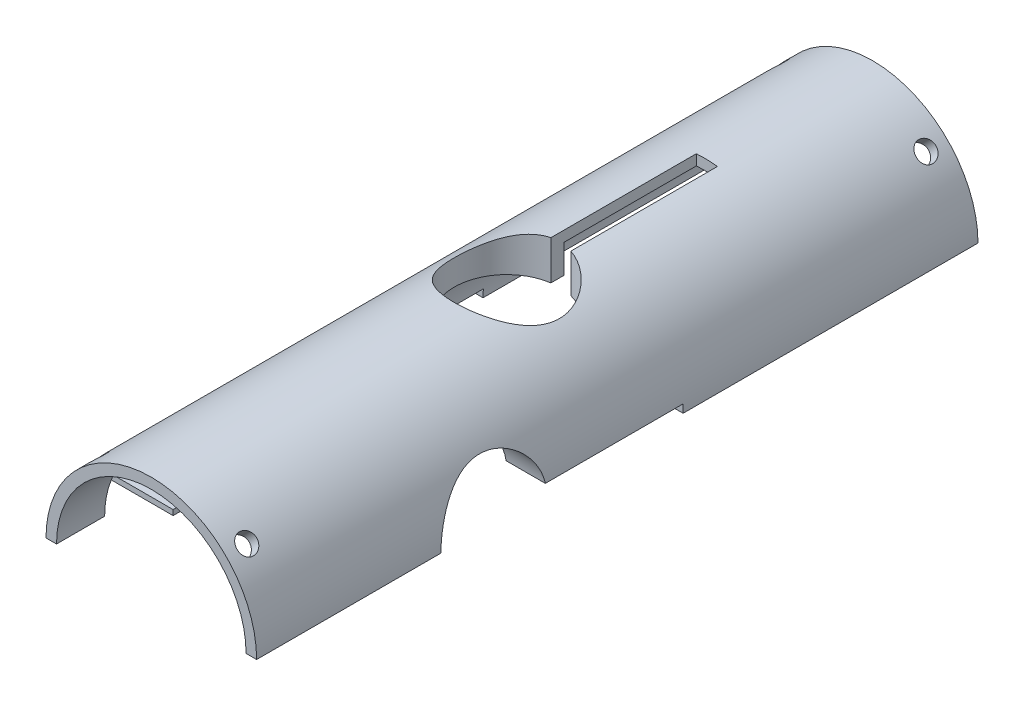
from build123d import *
from build123d.topology import SkipClean

# Parameters (mm, degrees)
SKETCH1_R                 = 20.000000000000004
SKETCH1_R_2               = 18.000000000000004
BOSS_EXTRUDE1_DEPTH       = 30
SKETCH2_R                 = 10.000000000000005
CUT_EXTRUDE1_DEPTH        = 20
SKETCH3_W                 = 3
SKETCH3_H                 = 14.18919425162652
CUT_EXTRUDE2_DEPTH        = 25
BOSS_EXTRUDE2_START       = 22.5
BOSS_EXTRUDE2_DEPTH       = 22.5
BOSS_EXTRUDE3_START       = 32
SKETCH5_R                 = 20
SKETCH5_R_2               = 18.000000000000004
BOSS_EXTRUDE3_DEPTH       = 32
SKETCH7_R                 = 20
SKETCH7_R_2               = 18.000000000000004
BOSS_EXTRUDE5_DEPTH       = 52.5
SKETCH8_R                 = 10.000000000000002
CUT_EXTRUDE3_DEPTH        = 22.500000000000004
CUT_EXTRUDE7_DEPTH        = 94.84162204766672
BOSS_EXTRUDE6_REACH       = 92.898
SKETCH17_R                = 12.500000000000002
SKETCH17_R_2              = 9.999999999999961
BOSS_EXTRUDE7_REACH       = 89.214
BOSS_EXTRUDE7_END_RADIUS  = 18.000000000000004
CUT_EXTRUDE9_DEPTH        = 5
BOSS_EXTRUDE8_REACH       = 141.889
CUT_EXTRUDE10_START       = -9.140015981
CUT_EXTRUDE10_DEPTH       = 9.140015981
BOSS_EXTRUDE9_START       = -18
BOSS_EXTRUDE9_DEPTH       = 18
CUT_EXTRUDE12_START       = -5
CUT_EXTRUDE12_DEPTH       = 5
CUT_EXTRUDE13_DEPTH       = 93.50158778794676
CUT_EXTRUDE14_START       = -20.999999999999996
CUT_EXTRUDE14_DEPTH       = 20.999999999999996
BOSS_EXTRUDE10_REACH      = 92.898
BOSS_EXTRUDE10_END_RADIUS = 18.000000000000004
SKETCH29_R                = 12.500000000000004
SKETCH29_R_2              = 10.000000000000005
SKETCH30_W                = 4.0000000000000036
SKETCH30_H                = 3.5793485997430934
CUT_EXTRUDE15_DEPTH       = 35.50000000000001
SKETCH32_W                = 28.000000000000007
SKETCH32_H                = 3
CUT_EXTRUDE17_DEPTH       = 86
CUT_EXTRUDE18_REACH       = 97.591
CUT_EXTRUDE18_END_RADIUS  = 18.000000000000004
SKETCH33_R                = 1.875000000000003
CIRPATTERN3_COUNT         = 4
MIRROR3_COPY_1_REACH      = 97.591
MIRROR3_COPY_1_END_RADIUS = 18.000000000000004
MIRROR3_COPY_1_SKETCH_R   = 1.875000000000003
MIRROR3_COPY_2_REACH      = 97.591
MIRROR3_COPY_2_END_RADIUS = 18.000000000000004
MIRROR3_COPY_2_SKETCH_R   = 1.875000000000003
MIRROR3_COPY_3_REACH      = 97.591
MIRROR3_COPY_3_END_RADIUS = 18.000000000000004
MIRROR3_COPY_3_SKETCH_R   = 1.875000000000003
CUT_EXTRUDE20_DEPTH       = 140


# Read off the part's stored shape, not the designer's step: Boss-Extrude9
with BuildPart() as part:
    # Sketch1 → Boss-Extrude1 (new body)
    with BuildSketch(Plane.XY):
        Circle(SKETCH1_R)
        Circle(SKETCH1_R_2, mode=Mode.SUBTRACT)
    extrude(amount=BOSS_EXTRUDE1_DEPTH)

    # Sketch2 → Cut-Extrude1 (cut, symmetric)
    with BuildSketch(Plane(origin=(0, 0, 0), x_dir=(1, 0, 0), z_dir=(0, 1, 0))):
        with Locations(Location((0, -15, 0), (0, 0, 270))):
            Circle(SKETCH2_R)
    extrude(amount=CUT_EXTRUDE1_DEPTH, both=True, mode=Mode.SUBTRACT)

    # Sketch3 → Cut-Extrude2 (cut, symmetric)
    with BuildSketch(Plane(origin=(0, 0, 0), x_dir=(1, 0, 0), z_dir=(0, 1, 0))):
        with Locations((0, -0.9987420960771436)):
            Rectangle(SKETCH3_W, SKETCH3_H)
    extrude(amount=CUT_EXTRUDE2_DEPTH, both=True, mode=Mode.SUBTRACT)

    # Sketch4 → Boss-Extrude2 (add)
    with SkipClean():  # the faces are left unmerged after this step: merging them gives an invalid solid
        with BuildSketch(Plane(origin=(0, 0, 0), x_dir=(-1, 0, 0), z_dir=(0, 0, -1)).offset(BOSS_EXTRUDE2_START)):
            with BuildLine():
                ThreePointArc((1.5, -19.94367067517913), (20, -2e-15), (1.5000000000000044, 19.94367067517913))
                Line((1.5, 19.94367067517913), (1.5, 17.937391114652137))
                ThreePointArc((1.4999999999997762, 17.93739111465212), (18.000000000000004, 2.44e-15), (1.4999999999997808, -17.93739111465212))
                Line((1.5, -17.937391114652133), (1.5, -19.94367067517913))
            make_face()
            with BuildLine():
                Line((-1.5, 17.937391114652154), (-1.5, 19.94367067517913))
                ThreePointArc((-1.5, 19.94367067517913), (-20, 2.45e-15), (-1.5000000000000002, -19.94367067517913))
                Line((-1.5, -19.94367067517913), (-1.5, -17.937391114652154))
                ThreePointArc((-1.4999999999996771, -17.937391114652126), (-18.000000000000004, 2.2e-15), (-1.499999999999665, 17.937391114652126))
            make_face()
        extrude(amount=-BOSS_EXTRUDE2_DEPTH)

    # Sketch5 → Boss-Extrude3 (add)
    with SkipClean():  # the faces are left unmerged after this step: merging them gives an invalid solid
        with BuildSketch(Plane(origin=(0, 0, -22.5), x_dir=(-1, 0, 0), z_dir=(0, 0, -1)).offset(BOSS_EXTRUDE3_START)):
            Circle(SKETCH5_R)
            Circle(SKETCH5_R_2, mode=Mode.SUBTRACT)
        extrude(amount=-BOSS_EXTRUDE3_DEPTH)

    # Sketch7 → Boss-Extrude5 (add)
    with SkipClean():  # the faces are left unmerged after this step: merging them gives an invalid solid
        with BuildSketch(Plane.XY.offset(30)):
            with Locations(Location((0, 0, 0), (0, 0, 180))):
                Circle(SKETCH7_R)
            with Locations(Location((0, 0, 0), (0, 0, 180))):
                Circle(SKETCH7_R_2, mode=Mode.SUBTRACT)
        extrude(amount=BOSS_EXTRUDE5_DEPTH)

    # Sketch8 → Cut-Extrude3 (cut, symmetric)
    with SkipClean():  # the faces are left unmerged after this step: merging them gives an invalid solid
        with BuildSketch(Plane(origin=(0, 0, 0), x_dir=(0, 0, -1), z_dir=(1, 0, 0))):
            with Locations((-37.5, 0)):
                Circle(SKETCH8_R)
        extrude(amount=CUT_EXTRUDE3_DEPTH, both=True, mode=Mode.SUBTRACT)

    # Sketch14 → Cut-Extrude7 (cut, through all)
    with SkipClean():  # the faces are left unmerged after this step: merging them gives an invalid solid
        with BuildSketch(Plane(origin=(0, 20, 0), x_dir=(1, 0, 0), z_dir=(0, 1, 0))):
            Polygon((1.5, 22.5), (2.5, 22.5), (2.500000000000004, -5.317541634481452), (1.5000000000000036, -5.317541634481452), align=None)
        extrude(amount=-CUT_EXTRUDE7_DEPTH, mode=Mode.SUBTRACT)

    # Sketch17 → Boss-Extrude6 (add, up to next)
    with BuildSketch(Plane(origin=(12.5, 0, 0), x_dir=(0, 0, -1), z_dir=(1, 0, 0)), mode=Mode.PRIVATE) as boss_extrude6_sk1:
        with Locations(Location((-37.49999999999996, 3.469e-14, 0), (0, 0, 180))):
            Circle(SKETCH17_R)
        with Locations((-37.49999999999996, 3.469e-14)):
            Circle(SKETCH17_R_2, mode=Mode.SUBTRACT)
    boss_extrude6_tool1 = extrude(boss_extrude6_sk1.sketch, amount=BOSS_EXTRUDE6_REACH, mode=Mode.PRIVATE) - part.part
    boss_extrude6 = boss_extrude6_tool1.solids().sort_by_distance((12.5, 0, 25.353553))[0]
    add(boss_extrude6)

    # Boss-Extrude7: up to this cylinder (the profile starts inside it)
    with SkipClean():  # the faces are left unmerged after this step: merging them gives an invalid solid
        boss_extrude7_end = Plane(origin=(0, 0, 62.959984), z_dir=(0, 0, -1)) * Cylinder(BOSS_EXTRUDE7_END_RADIUS, 215.428, mode=Mode.PRIVATE)
        # Sketch18 → Boss-Extrude7 (add, up to the surface)
        with BuildSketch(Plane(origin=(0, 0, 0), x_dir=(0, 0, -1), z_dir=(1, 0, 0)), mode=Mode.PRIVATE) as boss_extrude7_sk1:
            with BuildLine():
                Line((-73.35998401853058, 6.599999999999998), (-52.55998401853059, 6.599999999999998))
                ThreePointArc((-52.55998401853059, 6.599999999999997), (-51.60538986392875, 6.204594154601842), (-51.20998401853059, 5.250000000000001))
                Line((-51.20998401853059, 5.250000000000001), (-51.20998401853059, -5.250000000000001))
                ThreePointArc((-51.20998401853059, -5.250000000000001), (-51.60538986392876, -6.204594154601836), (-52.55998401853059, -6.599999999999998))
                Line((-52.55998401853059, -6.599999999999998), (-73.35998401853058, -6.600000000000001))
                Line((-73.35998401853057, -6.6), (-73.35998401853058, -7.600000000000001))
                Line((-73.35998401853058, -7.600000000000001), (-52.55998401853059, -7.599999999999997))
                ThreePointArc((-52.55998401853059, -7.6), (-50.89828308274221, -6.911700935788383), (-50.20998401853059, -5.250000000000001))
                Line((-50.20998401853059, -5.250000000000001), (-50.20998401853059, 5.250000000000001))
                ThreePointArc((-50.20998401853059, 5.250000000000001), (-50.8982830827422, 6.911700935788389), (-52.55998401853059, 7.600000000000003))
                Line((-52.55998401853059, 7.600000000000001), (-73.35998401853058, 7.599999999999998))
                Line((-73.35998401853058, 7.599999999999998), (-73.35998401853057, 6.6))
            make_face()
        boss_extrude7_tool1 = extrude(boss_extrude7_sk1.sketch, amount=-BOSS_EXTRUDE7_REACH, mode=Mode.PRIVATE) & boss_extrude7_end
        add(boss_extrude7_tool1.solids().sort_by_distance((0, 6.876941, 62.959984))[0])

    # Sketch19 → Cut-Extrude9 (cut)
    with SkipClean():  # the faces are left unmerged after this step: merging them gives an invalid solid
        with BuildSketch(Plane(origin=(0, 0, 0), x_dir=(0, 0, -1), z_dir=(1, 0, 0))):
            with BuildLine():
                Line((-50.20998401853059, -5.250000000000001), (-50.20998401853059, 5.250000000000001))
                ThreePointArc((-50.20998401853059, 5.250000000000001), (-50.8982830827422, 6.911700935788389), (-52.55998401853059, 7.6000000000000005))
                Line((-52.55998401853059, 7.6000000000000005), (-73.35998401853058, 7.599999999999998))
                Line((-73.35998401853058, 7.599999999999998), (-73.35998401853058, 6.599999999999998))
                Line((-73.35998401853058, 6.599999999999998), (-52.55998401853059, 6.599999999999998))
                ThreePointArc((-52.55998401853059, 6.599999999999998), (-51.60538986392875, 6.204594154601841), (-51.20998401853059, 5.250000000000001))
                Line((-51.20998401853059, 5.250000000000001), (-51.20998401853059, -5.250000000000001))
                ThreePointArc((-51.20998401853059, -5.250000000000001), (-51.60538986392876, -6.204594154601838), (-52.55998401853059, -6.599999999999998))
                Line((-52.55998401853059, -6.599999999999998), (-73.35998401853058, -6.600000000000001))
                Line((-73.35998401853058, -6.600000000000001), (-73.35998401853058, -7.600000000000001))
                Line((-73.35998401853058, -7.600000000000001), (-52.55998401853059, -7.599999999999997))
                ThreePointArc((-52.55998401853059, -7.599999999999997), (-50.89828308274221, -6.911700935788385), (-50.20998401853059, -5.250000000000001))
            make_face()
        extrude(amount=-CUT_EXTRUDE9_DEPTH, mode=Mode.SUBTRACT)

    # Sketch20 → Boss-Extrude8 (add, up to next)
    with BuildSketch(Plane.XY.offset(82.49999999999999), mode=Mode.PRIVATE) as boss_extrude8_sk1:
        with BuildLine():
            Line((-16.746342884343438, -6.600000000000001), (-16.746342884343438, 6.599999999999998))
            ThreePointArc((-16.746342884343434, 6.600000000000001), (-18, 2.2e-15), (-16.746342884343438, -6.599999999999998))
        make_face()
    boss_extrude8_tool1 = extrude(boss_extrude8_sk1.sketch, amount=-BOSS_EXTRUDE8_REACH, mode=Mode.PRIVATE) - part.part
    add(boss_extrude8_tool1.solids().sort_by_distance((-17.249333, 0, 82.5))[0])

    # Sketch21 → Cut-Extrude10 (cut)
    with SkipClean():  # the faces are left unmerged after this step: merging them gives an invalid solid
        with BuildSketch(Plane.XY.offset(82.49999999999999).offset(CUT_EXTRUDE10_START)):
            with BuildLine():
                ThreePointArc((-16.746342884343434, 6.600000000000001), (-18, 2.2e-15), (-16.746342884343438, -6.599999999999998))
                Line((-16.746342884343438, -6.600000000000003), (-16.746342884343438, 6.600000000000003))
            make_face()
            with BuildLine():
                Line((-16.746342884343438, 6.600000000000003), (-16.746342884343438, -6.600000000000003))
                ThreePointArc((-16.746342884343438, -6.599999999999998), (3.3590049182621122, -17.683808581838104), (18, -4.41e-15))
                ThreePointArc((18, 0), (3.3590049182621167, 17.683808581838104), (-16.746342884343434, 6.600000000000001))
            make_face()
        extrude(amount=CUT_EXTRUDE10_DEPTH, mode=Mode.SUBTRACT)

    # Boss-Extrude9 outline → Boss-Extrude9 (add)
    with SkipClean():  # the faces are left unmerged after this step: merging them gives an invalid solid
        with BuildSketch(Plane(origin=(50.804275903139434, 0, -12.243053878130752), x_dir=(0, 0, -1), z_dir=(0, 1, 0)).offset(BOSS_EXTRUDE9_START)):
            with BuildLine():
                ThreePointArc((12.856946122, 57.908219312), (11.195245186, 57.219920248), (10.506946122, 55.558219312))
                Line((10.506946122, 55.558219312), (10.506946122, 45.045105532))
                ThreePointArc((10.506946122, 45.045105532), (11.199853903, 43.391882613), (12.856917722, 42.708211121))
                Line((12.856917722, 42.708211121), (33.656945683, 42.708219312))
                Line((33.656945683, 42.708219312), (33.656945733, 43.708219312))
                Line((33.656945733, 43.708219312), (12.856917722, 43.708211121))
                ThreePointArc((12.856917722, 43.708211121), (11.905838377, 44.100111702), (11.506946122, 45.048279912))
                Line((11.506946122, 45.048279912), (11.506946122, 55.558219312))
                ThreePointArc((11.506946122, 55.558219312), (11.902351968, 56.512813466), (12.856946122, 56.908219312))
                Line((12.856946122, 56.908219312), (33.656946122, 56.908219312))
                Line((33.656946122, 56.908219312), (33.656946447, 57.908219312))
                Line((33.656946447, 57.908219312), (12.856946122, 57.908219312))
            make_face()
        extrude(amount=BOSS_EXTRUDE9_DEPTH)

    # Sketch26 → Cut-Extrude12 (cut)
    with SkipClean():  # the faces are left unmerged after this step: merging them gives an invalid solid
        with BuildSketch(Plane(origin=(0, 0, 0), x_dir=(-1, 0, 0), z_dir=(0, 1, 0)).offset(CUT_EXTRUDE12_START)):
            with BuildLine():
                Line((-8.096064781732366, -25.099971600575135), (-8.096056591348372, -45.89999956080974))
                Line((-8.096056591348372, -45.89999956080974), (-7.096056591348369, -45.89999956080974))
                Line((-7.096056591348369, -45.89999956080974), (-7.096064781732365, -25.099971600575135))
                ThreePointArc((-7.096064781732365, -25.099971600575135), (-6.704164201464376, -24.148892255031903), (-5.755995991066618, -23.75))
                Line((-5.755995991066618, -23.75), (4.753943408626532, -23.74999999996665))
                ThreePointArc((4.753943408626532, -23.74999999996665), (5.708537563243819, -24.145405845382772), (6.103943408648366, -25.100000000000065))
                Line((6.103943408648366, -25.100000000000065), (6.1039434086368125, -45.900000000000055))
                Line((6.1039434086368125, -45.900000000000055), (7.103943408636799, -45.90000032526164))
                Line((7.103943408636799, -45.90000032526164), (7.103943408636813, -25.100000000000065))
                ThreePointArc((7.103943408636813, -25.100000000000065), (6.415644344422198, -23.438299064204394), (4.753943408626532, -22.74999999996665))
                Line((4.753943408626532, -22.74999999996665), (-5.759170371377929, -22.75))
                ThreePointArc((-5.759170371377929, -22.75), (-7.412393289818503, -23.442907780994286), (-8.096064781732366, -25.099971600575135))
            make_face()
        extrude(amount=CUT_EXTRUDE12_DEPTH, mode=Mode.SUBTRACT)

    # Sketch27 → Cut-Extrude13 (cut, through all)
    with SkipClean():  # the faces are left unmerged after this step: merging them gives an invalid solid
        with BuildSketch(Plane(origin=(-16.746342884343438, 0, 0), x_dir=(0, 0, -1), z_dir=(1, 0, 0))):
            with BuildLine():
                Line((-52.55998401853059, 6.599999999999998), (-73.35998401853058, 6.599999999999998))
                Line((-73.35998401853058, 6.599999999999998), (-73.35998401853011, -6.600000000000003))
                Line((-73.35998401853011, -6.600000000000003), (-52.55998401853059, -6.599999999999994))
                ThreePointArc((-52.55998401853059, -6.599999999999994), (-51.60538986392876, -6.2045941546018355), (-51.20998401853059, -5.250000000000001))
                Line((-51.20998401853059, -5.250000000000001), (-51.20998401853059, 5.250000000000001))
                ThreePointArc((-51.20998401853059, 5.250000000000001), (-51.60538986392875, 6.204594154601841), (-52.55998401853059, 6.599999999999998))
            make_face()
        extrude(amount=-CUT_EXTRUDE13_DEPTH, mode=Mode.SUBTRACT)

    # Sketch28 → Cut-Extrude14 (cut)
    with SkipClean():  # the faces are left unmerged after this step: merging them gives an invalid solid
        with BuildSketch(Plane(origin=(0, -5, 0), x_dir=(1, 0, 0), z_dir=(0, 1, 0)).offset(CUT_EXTRUDE14_START)):
            with BuildLine():
                Line((-6.1039434086368125, 45.900000000000055), (7.096056591348369, 45.89999956080974))
                Line((7.096056591348369, 45.89999956080974), (7.096064781732365, 25.099971600575135))
                ThreePointArc((7.096064781732365, 25.099971600575135), (6.704164201464375, 24.148892255031907), (5.755995991066618, 23.75))
                Line((5.755995991066618, 23.75), (-4.753943408626532, 23.749999999972427))
                ThreePointArc((-4.753943408626532, 23.749999999972427), (-5.708537563247905, 24.145405845378683), (-6.103943408648366, 25.100000000000065))
                Line((-6.103943408648366, 25.100000000000065), (-6.1039434086368125, 45.900000000000055))
            make_face()
        extrude(amount=CUT_EXTRUDE14_DEPTH, mode=Mode.SUBTRACT)

    # Mirror1: Boss-Extrude6 across plane
    with SkipClean():  # the faces are left unmerged after this step: merging them gives an invalid solid
        add(boss_extrude6.mirror(Plane(origin=(0, 0, 0), x_dir=(0, 0, 1), z_dir=(1, 0, 0))))

    # Boss-Extrude10: up to this cylinder (the profile starts inside it)
    with SkipClean():  # the faces are left unmerged after this step: merging them gives an invalid solid
        boss_extrude10_end = Plane(origin=(0, 0, 27.058675), z_dir=(0, 0, -1)) * Cylinder(BOSS_EXTRUDE10_END_RADIUS, 222.796, mode=Mode.PRIVATE)
        # Sketch29 → Boss-Extrude10 (add, up to the surface)
        with BuildSketch(Plane(origin=(0, 12.5, 0), x_dir=(1, 0, 0), z_dir=(0, 1, 0)), mode=Mode.PRIVATE) as boss_extrude10_sk1:
            with Locations(Location((-2.27075e-12, -14.999999999999979, 0), (0, 0, 96.892101339))):
                Circle(SKETCH29_R)
            with Locations(Location((-2.27075e-12, -14.999999999999979, 0), (0, 0, 270))):
                Circle(SKETCH29_R_2, mode=Mode.SUBTRACT)
        boss_extrude10_tool1 = extrude(boss_extrude10_sk1.sketch, amount=BOSS_EXTRUDE10_REACH, mode=Mode.PRIVATE) & boss_extrude10_end
        boss_extrude10 = boss_extrude10_tool1.solids().sort_by_distance((1.457573, 12.5, 27.058675))[0]
        add(boss_extrude10)

    # Mirror2: Boss-Extrude10 across plane
    with SkipClean():  # the faces are left unmerged after this step: merging them gives an invalid solid
        add(boss_extrude10.mirror(Plane.ZX))

    # Sketch30 → Cut-Extrude15 (cut, symmetric)
    with SkipClean():  # the faces are left unmerged after this step: merging them gives an invalid solid
        with BuildSketch(Plane(origin=(0, -12.5, 0), x_dir=(1, 0, 0), z_dir=(0, 1, 0))):
            with Locations((0.5000000000000021, -3.5278673346099048)):
                Rectangle(SKETCH30_W, SKETCH30_H)
        extrude(amount=CUT_EXTRUDE15_DEPTH, both=True, mode=Mode.SUBTRACT)

    # Sketch32 → Cut-Extrude17 (cut)
    with SkipClean():  # the faces are left unmerged after this step: merging them gives an invalid solid
        with BuildSketch(Plane(origin=(20, 0, 0), x_dir=(0, 0, -1), z_dir=(1, 0, 0))):
            with Locations((-15.5, 0)):
                Rectangle(SKETCH32_W, SKETCH32_H)
        extrude(amount=-CUT_EXTRUDE17_DEPTH, mode=Mode.SUBTRACT)

    # Cut-Extrude18: up to this cylinder (the profile starts outside it)
    with SkipClean():  # the faces are left unmerged after this step: merging them gives an invalid solid
        cut_extrude18_end = Plane(origin=(0, 0, -50.5), z_dir=(0, 0, -1)) * Cylinder(CUT_EXTRUDE18_END_RADIUS, 232.182, mode=Mode.PRIVATE)
        # Sketch33 → Cut-Extrude18 (cut, up to the surface)
        with BuildSketch(Plane(origin=(-14.142135623730981, -14.142135623730931, 0), x_dir=(0, 0, -1), z_dir=(-0.7071067811865488, -0.7071067811865464, 0)), mode=Mode.PRIVATE) as cut_extrude18_sk1:
            with Locations(Location((50.5, 0, 0), (0, 0, 90))):
                Circle(SKETCH33_R)
        cut_extrude18_tool1 = extrude(cut_extrude18_sk1.sketch, amount=-CUT_EXTRUDE18_REACH, mode=Mode.PRIVATE) - cut_extrude18_end
        cut_extrude18 = cut_extrude18_tool1.solids().sort_by_distance((-14.142136, -14.142136, -50.5))[0]
        add(cut_extrude18, mode=Mode.SUBTRACT)

    # CirPattern3: Cut-Extrude18 ×4 about axis
    with SkipClean():  # the faces are left unmerged after this step: merging them gives an invalid solid
        cirpattern3_axis = Axis((0, 0, 30), (0, 0, -1))
        for i in range(1, CIRPATTERN3_COUNT):
            add(cut_extrude18.rotate(cirpattern3_axis, i * 360 / CIRPATTERN3_COUNT), mode=Mode.SUBTRACT)

    # Mirror3: Cut-Extrude18 across plane
    with SkipClean():  # the faces are left unmerged after this step: merging them gives an invalid solid
        add(cut_extrude18.mirror(Plane.XY.offset(13.999999999999995)), mode=Mode.SUBTRACT)

    # Mirror3 copy 1: up to this cylinder (the profile starts outside it)
    with SkipClean():  # the faces are left unmerged after this step: merging them gives an invalid solid
        mirror3_copy_1_end = Plane(origin=(0, 0, -50.5), z_dir=(0, 0, -1)) * Cylinder(MIRROR3_COPY_1_END_RADIUS, 232.182, mode=Mode.PRIVATE)
        # Mirror3 copy 1 sketch → Mirror3 copy 1 (cut, up to the surface)
        with BuildSketch(Plane(origin=(-14.142135623730931, 14.142135623730981, 27.99999999999999), x_dir=(0, 0, 1), z_dir=(-0.7071067811865464, 0.7071067811865488, 0)), mode=Mode.PRIVATE) as mirror3_copy_1_sk1:
            with Locations((50.5, 0)):
                Circle(MIRROR3_COPY_1_SKETCH_R)
        mirror3_copy_1_tool1 = extrude(mirror3_copy_1_sk1.sketch, amount=-MIRROR3_COPY_1_REACH, mode=Mode.PRIVATE) - mirror3_copy_1_end
        add(mirror3_copy_1_tool1.solids().sort_by_distance((-14.142136, -14.142136, -50.5))[0], mode=Mode.SUBTRACT)

    # Mirror3 copy 2: up to this cylinder (the profile starts outside it)
    with SkipClean():  # the faces are left unmerged after this step: merging them gives an invalid solid
        mirror3_copy_2_end = Plane(origin=(0, 0, -50.5), z_dir=(0, 0, -1)) * Cylinder(MIRROR3_COPY_2_END_RADIUS, 232.182, mode=Mode.PRIVATE)
        # Mirror3 copy 2 sketch → Mirror3 copy 2 (cut, up to the surface)
        with BuildSketch(Plane(origin=(14.14213562373098, 14.142135623730933, 27.99999999999999), x_dir=(0, 0, 1), z_dir=(0.7071067811865487, 0.7071067811865465, 0)), mode=Mode.PRIVATE) as mirror3_copy_2_sk1:
            with Locations((50.5, 0)):
                Circle(MIRROR3_COPY_2_SKETCH_R)
        mirror3_copy_2_tool1 = extrude(mirror3_copy_2_sk1.sketch, amount=-MIRROR3_COPY_2_REACH, mode=Mode.PRIVATE) - mirror3_copy_2_end
        add(mirror3_copy_2_tool1.solids().sort_by_distance((-14.142136, -14.142136, -50.5))[0], mode=Mode.SUBTRACT)

    # Mirror3 copy 3: up to this cylinder (the profile starts outside it)
    with SkipClean():  # the faces are left unmerged after this step: merging them gives an invalid solid
        mirror3_copy_3_end = Plane(origin=(0, 0, -50.5), z_dir=(0, 0, -1)) * Cylinder(MIRROR3_COPY_3_END_RADIUS, 232.182, mode=Mode.PRIVATE)
        # Mirror3 copy 3 sketch → Mirror3 copy 3 (cut, up to the surface)
        with BuildSketch(Plane(origin=(14.142135623730933, -14.14213562373098, 27.99999999999999), x_dir=(0, 0, 1), z_dir=(0.7071067811865465, -0.7071067811865487, 0)), mode=Mode.PRIVATE) as mirror3_copy_3_sk1:
            with Locations((50.5, 0)):
                Circle(MIRROR3_COPY_3_SKETCH_R)
        mirror3_copy_3_tool1 = extrude(mirror3_copy_3_sk1.sketch, amount=-MIRROR3_COPY_3_REACH, mode=Mode.PRIVATE) - mirror3_copy_3_end
        add(mirror3_copy_3_tool1.solids().sort_by_distance((-14.142136, -14.142136, -50.5))[0], mode=Mode.SUBTRACT)

    # Sketch34 → Cut-Extrude20 (cut)
    with SkipClean():  # the faces are left unmerged after this step: merging them gives an invalid solid
        with BuildSketch(Plane(origin=(0, 0, -54.5), x_dir=(-1, 0, 0), z_dir=(0, 0, -1))):
            Polygon((-34.36116383069801, 0), (42.35063346433313, 0), (22.18347211222843, -34.50075736841843), (-32.701840428309644, -35.3942392004737), align=None)
        extrude(amount=-CUT_EXTRUDE20_DEPTH, mode=Mode.SUBTRACT)


solid = part.part
